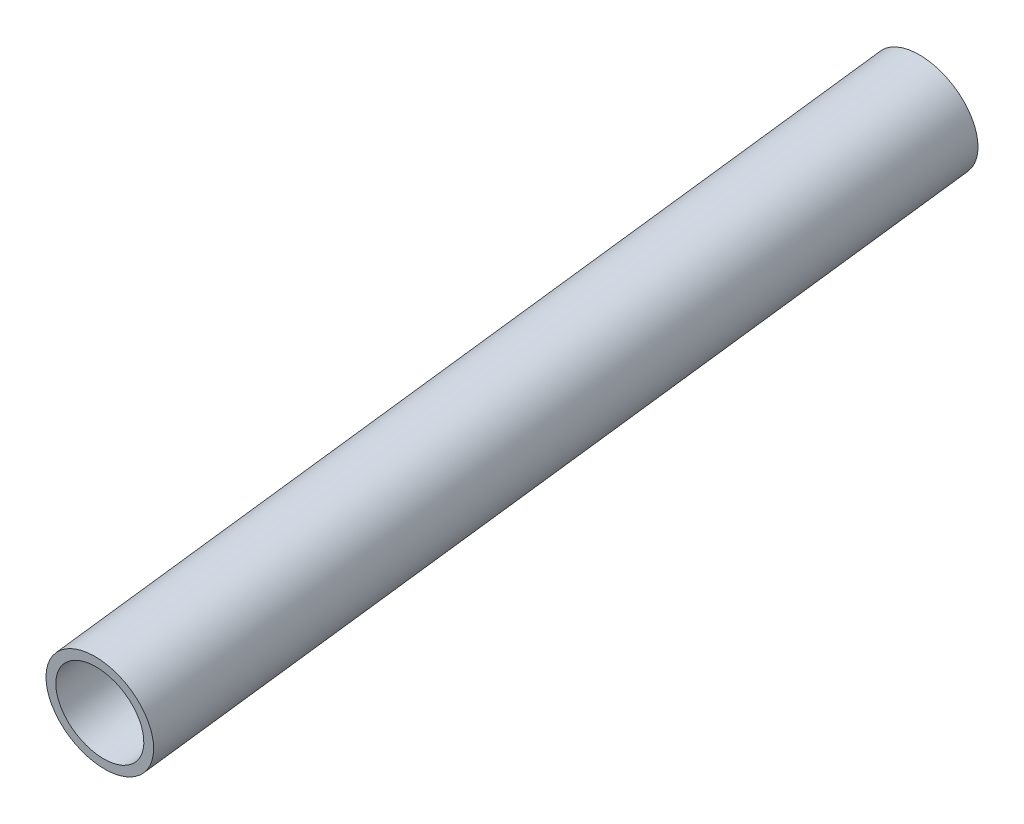
from build123d import *
from OCP.BRepAlgoAPI import BRepAlgoAPI_Cut
from OCP.TopTools import TopTools_ListOfShape

# Parameters (mm, degrees)
BOSS_EXTRUDE1_DEPTH      = 50.939854
BOSS_EXTRUDE1_DEPTH_BACK = 50.939854
SKETCH1_R                = 6.35
SKETCH2_R                = 5.1943
CUT_EXTRUDE1_DEPTH       = 957.325417785


with BuildPart() as part:
    # Sketch1 → Boss-Extrude1 (new, two sides: drawn at the far end of the back side and taken through both)
    with BuildSketch(Plane(origin=(-799.09430633, 449.142946775, 290.960929644), x_dir=(0.999849908974053, 0.005527775299574572, -0.016419598801901716), z_dir=(-0.016935681028085545, 0.11202937882799638, -0.99356056734732)).offset(-BOSS_EXTRUDE1_DEPTH_BACK)):
        with Locations(Location((0, 0, 0), (0, 0, 90.2093149))):
            Circle(SKETCH1_R)
    extrude(amount=BOSS_EXTRUDE1_DEPTH + BOSS_EXTRUDE1_DEPTH_BACK)


with BuildPart() as cut_extrude1_tool:
    # Sketch2 → Cut-Extrude1 (new, through all)
    with BuildSketch(Plane(origin=(2.951839092, -19.526389243, 173.174667012), x_dir=(0.999849908974053, 0.005527775299574602, -0.01641959880190172), z_dir=(-0.01693568102808555, 0.1120293788279964, -0.9935605673473199))):
        with Locations(Location((-801.269069891, -481.846011212, 0), (0, 0, 270.2093149))):
            Circle(SKETCH2_R)
    extrude(amount=-CUT_EXTRUDE1_DEPTH)


with BuildPart() as part_1:
    add(part.part)

    # Cut-Extrude1: cut by cut_extrude1_tool, with a tolerance
    cut_extrude1_stock = TopTools_ListOfShape()
    cut_extrude1_stock.Append(part_1.part.wrapped)
    cut_extrude1_tools = TopTools_ListOfShape()
    cut_extrude1_tools.Append(cut_extrude1_tool.part.wrapped)
    cut_extrude1_cut = BRepAlgoAPI_Cut()
    cut_extrude1_cut.SetArguments(cut_extrude1_stock)
    cut_extrude1_cut.SetTools(cut_extrude1_tools)
    cut_extrude1_cut.SetFuzzyValue(0.00001)
    cut_extrude1_cut.Build()
    add(Compound.cast(cut_extrude1_cut.Shape()).solids(), mode=Mode.REPLACE)


solid = part_1.part
